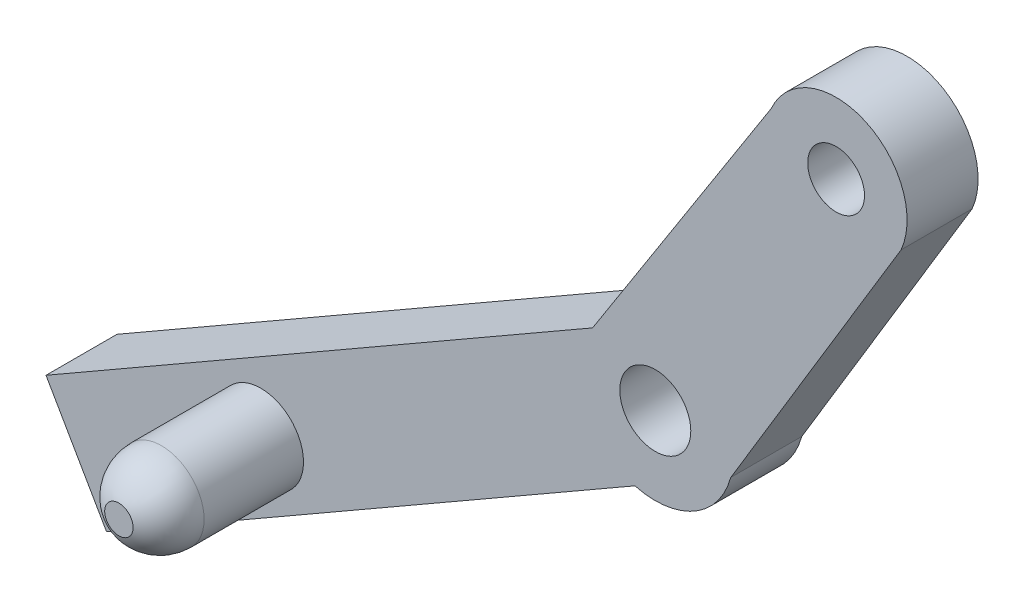
from build123d import *

# Parameters (mm, degrees)
SKETCH1_R           = 2
SKETCH1_R_2         = 2.5
BOSS_EXTRUDE1_DEPTH = 5
SKETCH6_R           = 3
BOSS_EXTRUDE3_DEPTH = 10


with BuildPart() as part:
    # Sketch1 → Boss-Extrude1 (new body)
    with BuildSketch(Plane(origin=(0, 0, 0), x_dir=(0.4985289035363021, -0.866873077410351, 0), z_dir=(0, 0, 1))):
        with BuildLine():
            ThreePointArc((8.899126574, -3.909046337), (10.510039278, -0.019959041), (8.899126574, 3.869128256))
            Line((8.899126574, 3.869128256), (-2.35642803, 24.179978159))
            ThreePointArc((-2.35642803, 24.179978159), (-9.345167797, 25.255857552), (-10.421047189, 18.267117784))
            Line((-10.421047189, 18.267117784), (0.353553391, -2.434608777))
            Line((0.353553391, -2.434608777), (0.353553391, -46.838046337))
            Line((0.353553391, -46.838046337), (8.899126574, -46.838046337))
            Line((8.899126574, -46.838046337), (8.899126574, -3.909046337))
        make_face()
        with Locations((-6.38873761, 21.223547972)):
            Circle(SKETCH1_R, mode=Mode.SUBTRACT)
        with Locations((5.010039278, -0.019959041)):
            Circle(SKETCH1_R_2, mode=Mode.SUBTRACT)
    extrude(amount=BOSS_EXTRUDE1_DEPTH)

    # Sketch6 → Boss-Extrude3 (add)
    with BuildSketch(Plane.XY.offset(5)):
        with Locations((-25.293181008, -19.882635909)):
            Circle(SKETCH6_R)
    extrude(amount=BOSS_EXTRUDE3_DEPTH)

    # Sketch8 → Cut-Revolve9 (revolve, cut)
    with BuildSketch(Plane(origin=(2.306364199, -4.010449578, 0), x_dir=(0.8668730774103515, 0.49852890353630136, 0), z_dir=(0.4985289035363013, -0.8668730774103514, 0))):
        with BuildLine():
            Line((-30.838046337, 15), (-28.838046337, 15))
            Line((-28.838046337, 15), (-28.838046337, 12))
            ThreePointArc((-28.838046337, 12), (-29.383882881, 13.802775638), (-30.838046337, 15))
        make_face()
    revolve(axis=Axis((-25.293181008, -19.882635909, 15), (0, 0, -1)), mode=Mode.SUBTRACT)


solid = part.part
